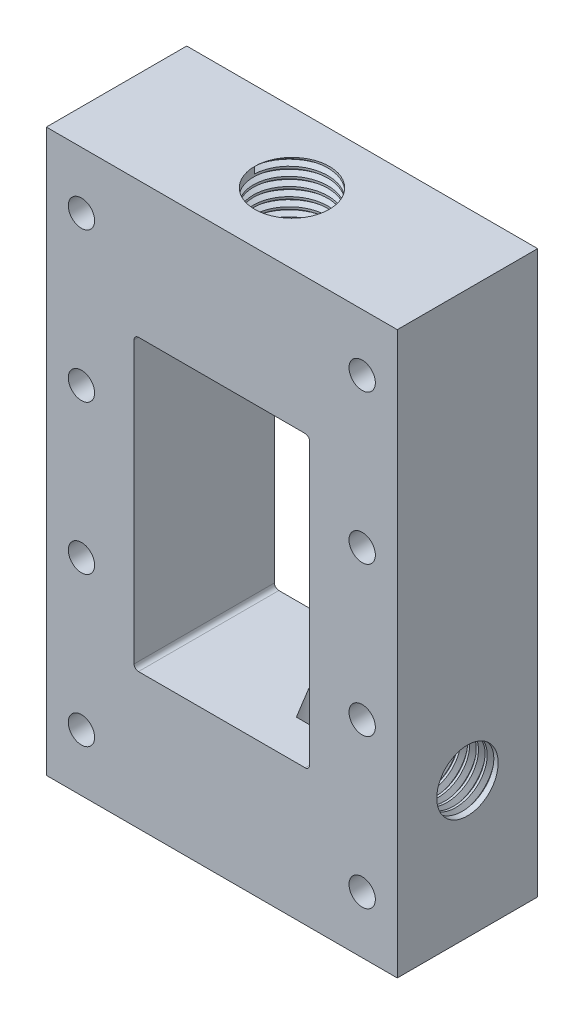
from build123d import *

# Parameters (mm, degrees)
SKETCH2_W                 = 40
SKETCH2_H                 = 64
BOSS_EXTRUDE1_DEPTH       = 16
CUT_EXTRUDE2_DEPTH        = 65.050814975
CUT_EXTRUDE2_DEPTH_BACK   = 65.050814975
SKETCH3_R                 = 1.5
M8X1_0_TAPPED_HOLE1_D     = 7
M8X1_0_TAPPED_HOLE1_DEPTH = 16
M8X1_0_TAPPED_HOLE1_TIP   = 2.103012167
THREAD3_PITCH             = 1
M10_TAPPED_HOLE1_D        = 8.5
M10_TAPPED_HOLE1_DEPTH    = 11
M10_TAPPED_HOLE1_TIP      = 2.553657631
THREAD5_PITCH             = 1


with BuildPart() as part:
    # Sketch2 → Boss-Extrude1 (new body)
    with BuildSketch(Plane.XY):
        with Locations((-4.32584577, 25.050505051)):
            Rectangle(SKETCH2_W, SKETCH2_H)
        with BuildLine():
            Line((-13.82584577, 41.550505051), (5.17415423, 41.550505051))
            ThreePointArc((5.17415423, 41.550505051), (5.527707621, 41.404058441), (5.67415423, 41.050505051))
            Line((5.67415423, 41.050505051), (5.67415423, 9.050505051))
            ThreePointArc((5.67415423, 9.050505051), (5.527707621, 8.69695166), (5.17415423, 8.550505051))
            Line((5.17415423, 8.550505051), (-13.82584577, 8.550505051))
            ThreePointArc((-13.82584577, 8.550505051), (-14.17939916, 8.69695166), (-14.32584577, 9.050505051))
            Line((-14.32584577, 9.050505051), (-14.32584577, 41.050505051))
            ThreePointArc((-14.32584577, 41.050505051), (-14.17939916, 41.404058441), (-13.82584577, 41.550505051))
        make_face(mode=Mode.SUBTRACT)
    extrude(amount=BOSS_EXTRUDE1_DEPTH)

    # Sketch3 → Cut-Extrude2 (cut, two sides: drawn at the far end of the back side and taken through both)
    with BuildSketch(Plane.XY.offset(16).offset(-CUT_EXTRUDE2_DEPTH_BACK)):
        with Locations((-20.32584577, -0.449494949)):
            Circle(SKETCH3_R)
        with Locations((-20.32584577, 16.550505051)):
            Circle(SKETCH3_R)
        with Locations((-20.32584577, 33.550505051)):
            Circle(SKETCH3_R)
        with Locations((-20.32584577, 50.550505051)):
            Circle(SKETCH3_R)
        with Locations((11.67415423, -0.449494949)):
            Circle(SKETCH3_R)
        with Locations((11.67415423, 16.550505051)):
            Circle(SKETCH3_R)
        with Locations((11.67415423, 33.550505051)):
            Circle(SKETCH3_R)
        with Locations((11.67415423, 50.550505051)):
            Circle(SKETCH3_R)
    extrude(amount=CUT_EXTRUDE2_DEPTH + CUT_EXTRUDE2_DEPTH_BACK, mode=Mode.SUBTRACT)

    # M8x1.0 Tapped Hole1
    with Locations(Plane(origin=(15.67415423, 0, 0), x_dir=(0, 0, -1), z_dir=(1, 0, 0))):
        with Locations((-8, 8.550505051)):
            Hole(M8X1_0_TAPPED_HOLE1_D / 2, depth=M8X1_0_TAPPED_HOLE1_DEPTH)
            with Locations((0, 0, -(M8X1_0_TAPPED_HOLE1_DEPTH + M8X1_0_TAPPED_HOLE1_TIP / 2))):  # 118° drill point
                Cone(0, M8X1_0_TAPPED_HOLE1_D / 2, M8X1_0_TAPPED_HOLE1_TIP, mode=Mode.SUBTRACT)

    # Thread3: the profile of Thread Profile3 profile screwed along a right-hand helix of 10 turns, 8 arcs to a turn; built about Z, then put on its axis
    thread3_z = Axis((0, 0, 0), (0, 0, 1))
    thread3_corners = [(3.4997, 0, -0.000173205), (4.041265875, 0, 0.312499998), (4.041265875, 0, 0.437499998), (3.4997, 0, 0.750173202)]
    with BuildLine(mode=Mode.PRIVATE) as thread3_profile:
        Line(thread3_corners[0], thread3_corners[1])
        Line(thread3_corners[1], thread3_corners[2])
        Line(thread3_corners[2], thread3_corners[3])
        Line(thread3_corners[3], thread3_corners[0])
    thread3_cap = Face(thread3_profile.wire())
    thread3_turn_angles = [0, 22.5, 45, 67.5, 90, 112.5, 135, 157.5, 180, 202.5, 225, 247.5, 270, 292.5, 315, 337.5, 360]
    thread3_turn_weights = [1, 0.9238795325112867, 1, 0.9238795325112867, 1, 0.9238795325112867, 1, 0.9238795325112867, 1, 0.9238795325112867, 1, 0.9238795325112867, 1, 0.9238795325112867, 1, 0.9238795325112867, 1]
    thread3_turn_rails = [Edge.make_bspline([Vector(p[0], p[1], 0).rotate(thread3_z, thread3_turn_angles[k]) / thread3_turn_weights[k] + Vector(0, 0, p[2] + THREAD3_PITCH * thread3_turn_angles[k] / 360) for k in range(17)], [0, 0, 0, 1, 1, 2, 2, 3, 3, 4, 4, 5, 5, 6, 6, 7, 7, 8, 8, 8], 2, thread3_turn_weights) for p in thread3_corners]
    thread3_turn_sides = [Face.make_surface_from_curves(thread3_turn_rails[p[0]], thread3_turn_rails[p[1]]) for p in [(0, 1), (1, 2), (2, 3), (3, 0)]]
    thread3 = Plane(origin=(15.67415423, 8.550505051, 8), x_dir=(0, 0, 1), z_dir=(-1, 0, 0)) * Solid(Shell([*[p.moved(Location((0, 0, THREAD3_PITCH * i))) for i in range(10) for p in thread3_turn_sides], thread3_cap, thread3_cap.rotate(thread3_z, 3600).moved(Location((0, 0, THREAD3_PITCH * 3600 / 360)))]))
    add(thread3, mode=Mode.SUBTRACT)

    # M10 Tapped Hole1
    with Locations(Plane(origin=(0, 57.050505051, 0), x_dir=(1, 0, 0), z_dir=(0, 1, 0))):
        with Locations((-4.32584577, -8)):
            Hole(M10_TAPPED_HOLE1_D / 2, depth=M10_TAPPED_HOLE1_DEPTH)
            with Locations((0, 0, -(M10_TAPPED_HOLE1_DEPTH + M10_TAPPED_HOLE1_TIP / 2))):  # 118° drill point
                Cone(0, M10_TAPPED_HOLE1_D / 2, M10_TAPPED_HOLE1_TIP, mode=Mode.SUBTRACT)

    # Thread5: the profile of Thread Profile5 profile screwed along a right-hand helix of 11 turns, 8 arcs to a turn; built about Z, then put on its axis
    thread5_z = Axis((0, 0, 0), (0, 0, 1))
    thread5_corners = [(4.2497, 0, -0.000173205), (4.791265875, 0, 0.312499999), (4.791265875, 0, 0.437499999), (4.2497, 0, 0.750173203)]
    with BuildLine(mode=Mode.PRIVATE) as thread5_profile:
        Line(thread5_corners[0], thread5_corners[1])
        Line(thread5_corners[1], thread5_corners[2])
        Line(thread5_corners[2], thread5_corners[3])
        Line(thread5_corners[3], thread5_corners[0])
    thread5_cap = Face(thread5_profile.wire())
    thread5_turn_angles = [0, 22.5, 45, 67.5, 90, 112.5, 135, 157.5, 180, 202.5, 225, 247.5, 270, 292.5, 315, 337.5, 360]
    thread5_turn_weights = [1, 0.9238795325112867, 1, 0.9238795325112867, 1, 0.9238795325112867, 1, 0.9238795325112867, 1, 0.9238795325112867, 1, 0.9238795325112867, 1, 0.9238795325112867, 1, 0.9238795325112867, 1]
    thread5_turn_rails = [Edge.make_bspline([Vector(p[0], p[1], 0).rotate(thread5_z, thread5_turn_angles[k]) / thread5_turn_weights[k] + Vector(0, 0, p[2] + THREAD5_PITCH * thread5_turn_angles[k] / 360) for k in range(17)], [0, 0, 0, 1, 1, 2, 2, 3, 3, 4, 4, 5, 5, 6, 6, 7, 7, 8, 8, 8], 2, thread5_turn_weights) for p in thread5_corners]
    thread5_turn_sides = [Face.make_surface_from_curves(thread5_turn_rails[p[0]], thread5_turn_rails[p[1]]) for p in [(0, 1), (1, 2), (2, 3), (3, 0)]]
    thread5 = Plane(origin=(-4.32584577, 57.050505051, 8), x_dir=(-1, 0, 0), z_dir=(0, -1, 0)) * Solid(Shell([*[p.moved(Location((0, 0, THREAD5_PITCH * i))) for i in range(11) for p in thread5_turn_sides], thread5_cap, thread5_cap.rotate(thread5_z, 3960).moved(Location((0, 0, THREAD5_PITCH * 3960 / 360)))]))
    add(thread5, mode=Mode.SUBTRACT)


solid = part.part
